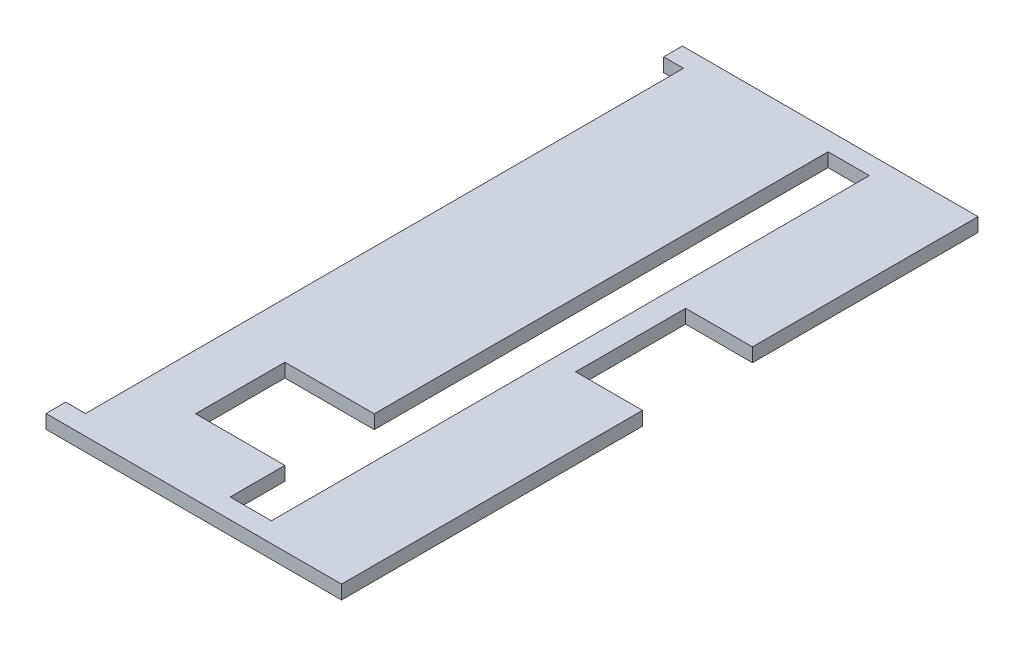
from build123d import *

# Parameters (mm, degrees)
SKETCH1_W           = 430
SKETCH1_H           = 463
BOSS_EXTRUDE1_DEPTH = 10
SKETCH2_W           = 48.6
SKETCH2_H           = 80
CUT_EXTRUDE1_DEPTH  = 10
SKETCH3_W           = 30
SKETCH3_H           = 435
SKETCH3_W_2         = 26
CUT_EXTRUDE2_DEPTH  = 10
SKETCH4_W           = 65
SKETCH4_H           = 65
CUT_EXTRUDE3_DEPTH  = 10
SKETCH5_W           = 636.219925535
SKETCH5_H           = 371.910781629
CUT_EXTRUDE7_DEPTH  = 360


with BuildPart() as part:
    # Sketch1 → Boss-Extrude1 (new body)
    with BuildSketch(Plane(origin=(0, 0, 0), x_dir=(1, 0, 0), z_dir=(0, 1, 0))):
        with Locations((6126.084066999, -8720.812377786)):
            Rectangle(SKETCH1_W, SKETCH1_H)
    extrude(amount=BOSS_EXTRUDE1_DEPTH)

    # Sketch2 → Cut-Extrude1 (cut)
    with BuildSketch(Plane(origin=(0, 10, 0), x_dir=(1, 0, 0), z_dir=(0, 1, 0))):
        with Locations((5935.384066999, -8693.059787309)):
            Rectangle(SKETCH2_W, SKETCH2_H)
        with Locations((6316.784066999, -8693.384418705)):
            Rectangle(SKETCH2_W, SKETCH2_H)
    extrude(amount=-CUT_EXTRUDE1_DEPTH, mode=Mode.SUBTRACT)

    # Sketch3 → Cut-Extrude2 (cut)
    with BuildSketch(Plane(origin=(0, 10, 0), x_dir=(1, 0, 0), z_dir=(0, 1, 0))):
        Polygon((5976.484066999, -8569.312377786), (5976.484066999, -8937.972826511), (6006.484066999, -8937.972826511), (6006.484066999, -8502.972826511), (5976.484066999, -8502.972826511), (5976.484066999, -8529.312377786), (5946.484066999, -8529.312377786), (5946.484066999, -8569.312377786), align=None)
        with Locations((6260.684066999, -8720.472826511)):
            Rectangle(SKETCH3_W, SKETCH3_H)
        with Locations((6127.484066999, -8720.472826511)):
            Rectangle(SKETCH3_W_2, SKETCH3_H)
    extrude(amount=-CUT_EXTRUDE2_DEPTH, mode=Mode.SUBTRACT)

    # Sketch4 → Cut-Extrude3 (cut)
    with BuildSketch(Plane(origin=(0, 10, 0), x_dir=(1, 0, 0), z_dir=(0, 1, 0))):
        with Locations((6213.184066999, -8865.596518708)):
            Rectangle(SKETCH4_W, SKETCH4_H)
    extrude(amount=-CUT_EXTRUDE3_DEPTH, mode=Mode.SUBTRACT)

    # Sketch5 → Cut-Extrude7 (cut)
    with BuildSketch(Plane.ZY.offset(-6126.084067)):
        with Locations((8713.796116909, -43.108967652)):
            Rectangle(SKETCH5_W, SKETCH5_H)
    extrude(amount=CUT_EXTRUDE7_DEPTH, mode=Mode.SUBTRACT)


solid = part.part
